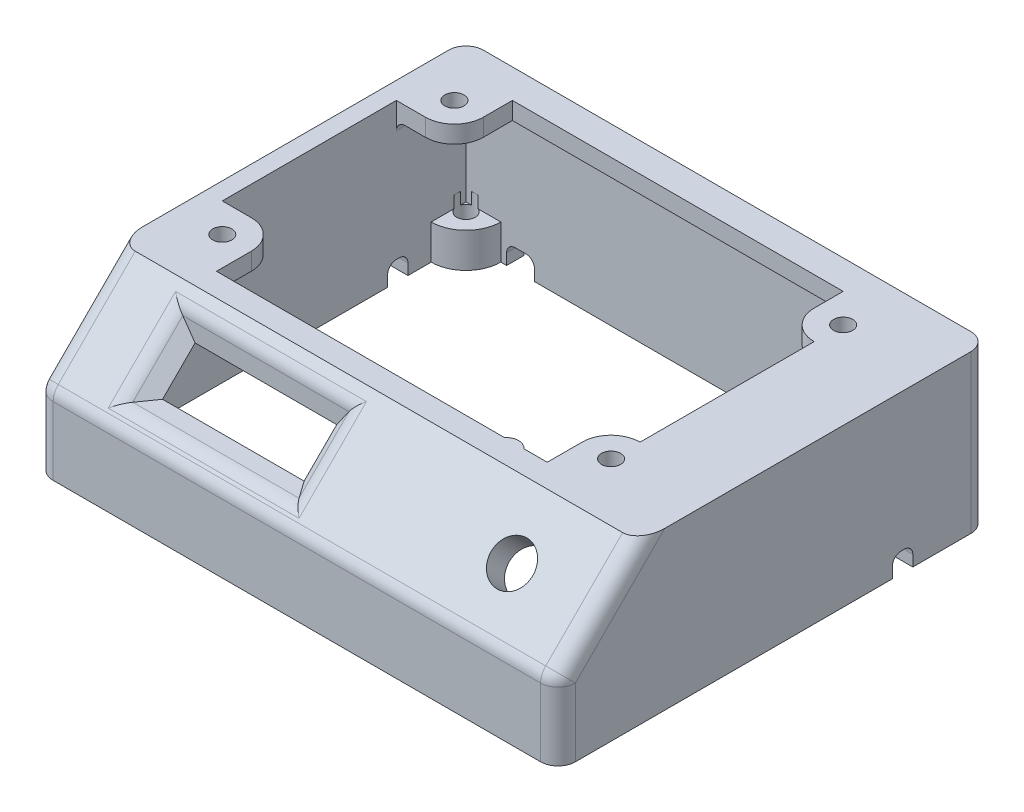
from build123d import *

# Parameters (mm, degrees)
SKETCH1_W                 = 90
SKETCH1_H                 = 60
BOSS_EXTRUDE1_DEPTH       = 3
SKETCH3_W                 = 89.99999999999999
SKETCH3_H                 = 20.000000000000004
BOSS_EXTRUDE2_DEPTH       = 3
SKETCH4_R                 = 3.600000000000001
CUT_EXTRUDE1_DEPTH        = 3
SKETCH5_R                 = 5.4999999999999964
SKETCH5_R_2               = 3.600000000000001
BOSS_EXTRUDE3_DEPTH       = 1.4
SKETCH6_W                 = 24.000000000000004
SKETCH6_H                 = 7.540000000000006
CUT_EXTRUDE2_DEPTH        = 3
CHAMFER1_SIZE             = 3.2
SKETCH7_R                 = 3.0000000000000018
SKETCH7_R_2               = 1.600000000000005
BOSS_EXTRUDE4_DEPTH       = 8.3
BOSS_EXTRUDE5_DEPTH       = 4
BOSS_EXTRUDE6_DEPTH       = 3
BOSS_EXTRUDE7_DEPTH       = 3
BOSS_EXTRUDE8_DEPTH       = 3
F_3_0MM_DOWEL_HOLE1_D     = 3.3
CUT_EXTRUDE3_DEPTH        = 3
BOSS_EXTRUDE9_DEPTH       = 6
F_1_0MM_DOWEL_HOLE1_D     = 3.2
F_1_0MM_DOWEL_HOLE1_DEPTH = 8
F_1_0MM_DOWEL_HOLE1_TIP   = 0.9613769904440965
FILLET1_R                 = 3
SKETCH20_W                = 3.000000000000014
SKETCH20_H                = 3.4999999999999982
CUT_EXTRUDE4_DEPTH        = 3.4
FILLET2_R                 = 1.5
CHAMFER2_SIZE             = 2.8


with BuildPart() as part:
    # Sketch1 → Boss-Extrude1 (new body)
    with BuildSketch(Plane(origin=(0, 0, 0), x_dir=(1, 0, 0), z_dir=(0, 1, 0))):
        Rectangle(SKETCH1_W, SKETCH1_H)
    extrude(amount=BOSS_EXTRUDE1_DEPTH)

    # Sketch3 → Boss-Extrude2 (add)
    with BuildSketch(Plane(origin=(0, 16.500000000000007, 16.499999999999954), x_dir=(1, 0, 0), z_dir=(0, 0.7071067811865488, 0.7071067811865464))):
        with Locations((-7.11e-15, -29.09188309203683)):
            Rectangle(SKETCH3_W, SKETCH3_H)
    extrude(amount=-BOSS_EXTRUDE2_DEPTH)

    # Sketch4 → Cut-Extrude1 (cut)
    with BuildSketch(Plane(origin=(0, 16.500000000000025, 16.499999999999964), x_dir=(1, 0, 0), z_dir=(0, 0.7071067811865486, 0.7071067811865465))):
        with Locations(Location((29.99999999999998, -29.09188309203682, 0), (0, 0, 270))):
            Circle(SKETCH4_R)
    extrude(amount=-CUT_EXTRUDE1_DEPTH, mode=Mode.SUBTRACT)

    # Sketch5 → Boss-Extrude3 (add)
    with BuildSketch(Plane(origin=(0, 14.378679656440374, 14.378679656440328), x_dir=(1, 0, 0), z_dir=(0, -0.7071067811865486, -0.7071067811865465))):
        with Locations(Location((29.99999999999998, 29.091883092036817, 0), (0, 0, 90))):
            Circle(SKETCH5_R)
        with Locations(Location((29.99999999999998, 29.091883092036817, 0), (0, 0, 90))):
            Circle(SKETCH5_R_2, mode=Mode.SUBTRACT)
    extrude(amount=BOSS_EXTRUDE3_DEPTH)

    # Sketch6 → Cut-Extrude2 (cut)
    with BuildSketch(Plane(origin=(0, 16.500000000000025, 16.499999999999964), x_dir=(1, 0, 0), z_dir=(0, 0.7071067811865486, 0.7071067811865465))):
        with Locations((-17.338558574922935, -29.09188309203713)):
            Rectangle(SKETCH6_W, SKETCH6_H)
    extrude(amount=-CUT_EXTRUDE2_DEPTH, mode=Mode.SUBTRACT)

    # Chamfer1
    # the kernel refuses this chamfer: 3.2 mm, written as the material it takes off along each edge
    with BuildSketch(Plane(origin=(-5.338558574922932, -1.4052752467923817, 34.40527524679243), x_dir=(0.9996219169112968, 0.019442520806010916, 0.019442520806010857), z_dir=(0, -0.7071067811865465, 0.7071067811865486))) as chamfer1_piece_1:
        Polygon((CHAMFER1_SIZE * 0.999621916911, -CHAMFER1_SIZE * 0.0274958766106), (-CHAMFER1_SIZE * 0.0274958766106, -CHAMFER1_SIZE * 0.999621916911), (0, 0), align=None)
    extrude(amount=7.5400000000000045, mode=Mode.SUBTRACT)
    with BuildSketch(Plane(origin=(-5.338558574922932, -6.736860376938946, 39.736860376939006), x_dir=(0, -0.6873969152646615, 0.7262819568766856), z_dir=(-1, 0, 0))) as chamfer1_piece_2:
        Polygon((CHAMFER1_SIZE * 0.999621916911, -CHAMFER1_SIZE * 0.0274958766106), (-CHAMFER1_SIZE * 0.0274958766106, -CHAMFER1_SIZE * 0.999621916911), (0, 0), align=None)
    extrude(amount=24.000000000000004, mode=Mode.SUBTRACT)
    with BuildSketch(Plane(origin=(-29.338558574922935, -1.4052752467923817, 34.40527524679243), x_dir=(0, 0.7262819568766835, -0.6873969152646636), z_dir=(1, 0, 0))) as chamfer1_piece_3:
        Polygon((CHAMFER1_SIZE * 0.999621916911, -CHAMFER1_SIZE * 0.0274958766106), (-CHAMFER1_SIZE * 0.0274958766106, -CHAMFER1_SIZE * 0.999621916911), (0, 0), align=None)
    extrude(amount=24.000000000000004, mode=Mode.SUBTRACT)
    with BuildSketch(Plane(origin=(-29.338558574922935, -6.736860376938946, 39.736860376939006), x_dir=(-0.9996219169112968, 0.019442520806011252, 0.019442520806011193), z_dir=(0, 0.7071067811865465, -0.7071067811865486))) as chamfer1_piece_4:
        Polygon((CHAMFER1_SIZE * 0.999621916911, -CHAMFER1_SIZE * 0.0274958766106), (-CHAMFER1_SIZE * 0.0274958766106, -CHAMFER1_SIZE * 0.999621916911), (0, 0), align=None)
    extrude(amount=7.5400000000000045, mode=Mode.SUBTRACT)
    with BuildSketch(Plane(origin=(-29.338558574922935, -1.4052752467923817, 34.40527524679243), x_dir=(0, 0.7262819568766835, -0.6873969152646636), z_dir=(1, 0, 0))) as chamfer1_piece_5a_section:
        Polygon((CHAMFER1_SIZE * 0.999621916911, -CHAMFER1_SIZE * 0.0274958766106), (-CHAMFER1_SIZE * 0.0274958766106, -CHAMFER1_SIZE * 0.999621916911), (0, 0), align=None)
    chamfer1_piece_5a = extrude(amount=32.229385561490915, mode=Mode.PRIVATE)
    chamfer1_piece_5a = split(chamfer1_piece_5a, bisect_by=Plane(origin=(-5.338558574922932, -1.4052752467923915, 32.91279966339028), z_dir=(1, 0, 0)), keep=Keep.TOP, mode=Mode.PRIVATE)
    with BuildSketch(Plane(origin=(-5.338558574922932, 4.413779088736488, 28.586220911263517), x_dir=(0.9996219169112966, 0.019442520806013983, 0.019442520806013924), z_dir=(0, -0.7071067811865465, 0.7071067811865486))) as chamfer1_piece_5b_section:
        Polygon((CHAMFER1_SIZE * 0.999621916911, -CHAMFER1_SIZE * 0.0274958766106), (-CHAMFER1_SIZE * 0.0274958766106, -CHAMFER1_SIZE * 0.999621916911), (0, 0), align=None)
    chamfer1_piece_5b = extrude(amount=15.769385561490923, mode=Mode.PRIVATE)
    chamfer1_piece_5b = split(chamfer1_piece_5b, bisect_by=Plane(origin=(-4.283218969143878, -2.1515130384933565, 33.65903745509146), z_dir=(0, 0.7071067811865466, -0.7071067811865486)), keep=Keep.TOP, mode=Mode.PRIVATE)
    chamfer1_piece_5 = chamfer1_piece_5a & chamfer1_piece_5b
    add(chamfer1_piece_5, mode=Mode.SUBTRACT)
    with BuildSketch(Plane(origin=(-5.338558574922932, -1.4052752467923817, 34.40527524679243), x_dir=(0.9996219169112968, 0.019442520806010916, 0.019442520806010857), z_dir=(0, -0.7071067811865465, 0.7071067811865486))) as chamfer1_piece_6a_section:
        Polygon((CHAMFER1_SIZE * 0.999621916911, -CHAMFER1_SIZE * 0.0274958766106), (-CHAMFER1_SIZE * 0.0274958766106, -CHAMFER1_SIZE * 0.999621916911), (0, 0), align=None)
    chamfer1_piece_6a = extrude(amount=15.76938556149092, mode=Mode.PRIVATE)
    chamfer1_piece_6a = split(chamfer1_piece_6a, bisect_by=Plane(origin=(-4.283218969143861, -7.4830981686397395, 38.990622585238214), z_dir=(0, -0.7071067811865466, 0.7071067811865486)), keep=Keep.TOP, mode=Mode.PRIVATE)
    with BuildSketch(Plane(origin=(2.8908269865679914, -6.736860376938956, 39.736860376939), x_dir=(0, -0.6873969152646588, 0.7262819568766881), z_dir=(-1, 0, 0))) as chamfer1_piece_6b_section:
        Polygon((CHAMFER1_SIZE * 0.999621916911, -CHAMFER1_SIZE * 0.0274958766106), (-CHAMFER1_SIZE * 0.0274958766106, -CHAMFER1_SIZE * 0.999621916911), (0, 0), align=None)
    chamfer1_piece_6b = extrude(amount=32.22938556149093, mode=Mode.PRIVATE)
    chamfer1_piece_6b = split(chamfer1_piece_6b, bisect_by=Plane(origin=(-5.338558574922932, -8.2293359603411, 39.736860376939), z_dir=(1, 0, 0)), keep=Keep.TOP, mode=Mode.PRIVATE)
    chamfer1_piece_6 = chamfer1_piece_6a & chamfer1_piece_6b
    add(chamfer1_piece_6, mode=Mode.SUBTRACT)
    with BuildSketch(Plane(origin=(-5.338558574922932, -6.736860376938946, 39.736860376939006), x_dir=(0, -0.6873969152646615, 0.7262819568766856), z_dir=(-1, 0, 0))) as chamfer1_piece_7a_section:
        Polygon((CHAMFER1_SIZE * 0.999621916911, -CHAMFER1_SIZE * 0.0274958766106), (-CHAMFER1_SIZE * 0.0274958766106, -CHAMFER1_SIZE * 0.999621916911), (0, 0), align=None)
    chamfer1_piece_7a = extrude(amount=32.22938556149093, mode=Mode.PRIVATE)
    chamfer1_piece_7a = split(chamfer1_piece_7a, bisect_by=Plane(origin=(-29.338558574922935, -8.229335960341102, 39.736860376939), z_dir=(-1, 0, 0)), keep=Keep.TOP, mode=Mode.PRIVATE)
    with BuildSketch(Plane(origin=(-29.338558574922935, -12.555914712467843, 45.5559147124679), x_dir=(-0.9996219169112966, 0.019442520806014486, 0.019442520806014427), z_dir=(0, 0.7071067811865465, -0.7071067811865486))) as chamfer1_piece_7b_section:
        Polygon((CHAMFER1_SIZE * 0.999621916911, -CHAMFER1_SIZE * 0.0274958766106), (-CHAMFER1_SIZE * 0.0274958766106, -CHAMFER1_SIZE * 0.999621916911), (0, 0), align=None)
    chamfer1_piece_7b = extrude(amount=15.76938556149093, mode=Mode.PRIVATE)
    chamfer1_piece_7b = split(chamfer1_piece_7b, bisect_by=Plane(origin=(-30.393898180701953, -7.483098168640018, 38.99062258523794), z_dir=(0, -0.7071067811865466, 0.7071067811865486)), keep=Keep.TOP, mode=Mode.PRIVATE)
    chamfer1_piece_7 = chamfer1_piece_7a & chamfer1_piece_7b
    add(chamfer1_piece_7, mode=Mode.SUBTRACT)
    with BuildSketch(Plane(origin=(-37.56794413641384, -1.4052752467923928, 34.405275246792414), x_dir=(0, 0.7262819568766864, -0.6873969152646605), z_dir=(1, 0, 0))) as chamfer1_piece_8a_section:
        Polygon((CHAMFER1_SIZE * 0.999621916911, -CHAMFER1_SIZE * 0.0274958766106), (-CHAMFER1_SIZE * 0.0274958766106, -CHAMFER1_SIZE * 0.999621916911), (0, 0), align=None)
    chamfer1_piece_8a = extrude(amount=32.229385561490915, mode=Mode.PRIVATE)
    chamfer1_piece_8a = split(chamfer1_piece_8a, bisect_by=Plane(origin=(-29.338558574922935, -1.405275246792396, 32.91279966339027), z_dir=(-1, 0, 0)), keep=Keep.TOP, mode=Mode.PRIVATE)
    with BuildSketch(Plane(origin=(-29.338558574922935, -6.736860376938946, 39.736860376939006), x_dir=(-0.9996219169112968, 0.019442520806011252, 0.019442520806011193), z_dir=(0, 0.7071067811865465, -0.7071067811865486))) as chamfer1_piece_8b_section:
        Polygon((CHAMFER1_SIZE * 0.999621916911, -CHAMFER1_SIZE * 0.0274958766106), (-CHAMFER1_SIZE * 0.0274958766106, -CHAMFER1_SIZE * 0.999621916911), (0, 0), align=None)
    chamfer1_piece_8b = extrude(amount=15.769385561490939, mode=Mode.PRIVATE)
    chamfer1_piece_8b = split(chamfer1_piece_8b, bisect_by=Plane(origin=(-30.393898180701893, -2.15151303849358, 33.65903745509123), z_dir=(0, 0.7071067811865466, -0.7071067811865486)), keep=Keep.TOP, mode=Mode.PRIVATE)
    chamfer1_piece_8 = chamfer1_piece_8a & chamfer1_piece_8b
    add(chamfer1_piece_8, mode=Mode.SUBTRACT)

    # Sketch7 → Boss-Extrude4 (add)
    with BuildSketch(Plane(origin=(0, 14.378679656440374, 14.378679656440328), x_dir=(1, 0, 0), z_dir=(0, -0.7071067811865486, -0.7071067811865465))):
        with Locations(Location((19.290000000000294, 20.841883092036912, 0), (0, 0, 350.263355366))):
            Circle(SKETCH7_R)
        with Locations(Location((19.290000000000294, 20.841883092036912, 0), (0, 0, 198.487609579))):
            Circle(SKETCH7_R_2, mode=Mode.SUBTRACT)
    extrude(amount=BOSS_EXTRUDE4_DEPTH)

    # Sketch8 → Boss-Extrude5 (add)
    with BuildSketch(Plane(origin=(0, 14.378679656440374, 14.378679656440328), x_dir=(1, 0, 0), z_dir=(0, -0.7071067811865486, -0.7071067811865465))):
        Polygon((-35.53855857492294, 23.871883092037123), (2.6614414250770646, 23.871883092037127), (2.6614414250770646, 36.071883092037126), (-35.53855857492294, 36.071883092037126), (-35.53855857492294, 38.971883092037125), (5.561441425077065, 38.971883092037125), (5.561441425077065, 20.971883092037128), (-35.53855857492294, 20.97188309203712), align=None)
    extrude(amount=BOSS_EXTRUDE5_DEPTH)

    # Sketch9 → Boss-Extrude6 (add)
    with BuildSketch(Plane.XY.offset(44.14213562373099)):
        Polygon((-44.99999999999999, -11.142135623730935), (44.99999999999998, -11.142135623730935), (44.99999999999997, -24.142135623730937), (-45, -24.142135623730937), align=None)
    extrude(amount=-BOSS_EXTRUDE6_DEPTH)

    # Sketch10 → Boss-Extrude7 (add)
    with BuildSketch(Plane(origin=(44.99999999999999, 0, 0), x_dir=(0, 0, -1), z_dir=(1, 0, 0))):
        Polygon((-28.75735931288073, -8.13e-15), (30.000000000000004, 0), (30.000000000000007, -24.142135623730937), (-41.14213562373099, -24.142135623730937), (-41.142135623730994, -12.384776310850228), align=None)
    boss_extrude7 = extrude(amount=-BOSS_EXTRUDE7_DEPTH)

    # Mirror1: Boss-Extrude7 across plane
    add(boss_extrude7.mirror(Plane(origin=(0, 0, 0), x_dir=(0, 0, 1), z_dir=(1, 0, 0))))

    # Sketch11 → Boss-Extrude8 (add)
    with BuildSketch(Plane(origin=(0, 0, -30.000000000000004), x_dir=(-1, 0, 0), z_dir=(0, 0, -1))):
        Polygon((41.999999999999986, -24.142135623730937), (-41.999999999999986, -24.142135623730947), (-41.999999999999986, 0), (41.999999999999986, 0), align=None)
    extrude(amount=-BOSS_EXTRUDE8_DEPTH)

    # Ø3.0mm Dowel Hole1 (through all)
    with Locations(Plane(origin=(0, 0, 0), x_dir=(-1, 0, 0), z_dir=(0, -1, 0))):
        with Locations((37, 20), (37, -20), (-30, 20), (-30, -20)):
            Hole(F_3_0MM_DOWEL_HOLE1_D / 2)

    # Sketch15 → Cut-Extrude3 (cut)
    with BuildSketch(Plane(origin=(0, 0, 0), x_dir=(-1, 0, 0), z_dir=(0, -1, 0))):
        with BuildLine():
            Line((-24.99999999999999, 20.000000000000007), (-24.99999999999999, 25))
            Line((-24.99999999999999, 25), (32.00000000000001, 25))
            Line((32.00000000000001, 25), (32.00000000000001, 20.000000000000004))
            ThreePointArc((32.00000000000001, 20.000000000000004), (33.46446609406727, 16.46446609406727), (37, 15.000000000000014))
            Line((37, 15.000000000000014), (41.99999999999999, 15.000000000000016))
            Line((41.99999999999999, 15.000000000000016), (41.99999999999999, -15.000000000000014))
            Line((41.99999999999999, -15.000000000000014), (36.99999999999999, -15.000000000000014))
            ThreePointArc((36.99999999999999, -15.000000000000014), (33.46446609406727, -16.46446609406727), (32.00000000000001, -19.999999999999996))
            Line((32.00000000000001, -19.999999999999996), (32, -25.999999999999996))
            Line((32, -25.999999999999996), (-17.568771872805467, -25.999999999999996))
            add(Edge.make_bspline(
                [(-17.568771872805467, -25.999999999999996), (-19.29000000000029, -24.294829399567405), (-21.011228127195118, -25.999999999999996)],
                knots=[2.5305244194596073, 2.5305244194596073, 2.5305244194596073, 3.7526608877199776, 3.7526608877199776, 3.7526608877199776], degree=2, weights=[1, 0.8190355937288819, 1]))
            Line((-21.011228127195118, -25.999999999999996), (-24.99999999999999, -25.999999999999996))
            Line((-24.99999999999999, -25.999999999999996), (-24.99999999999999, -19.999999999999996))
            ThreePointArc((-24.99999999999999, -19.999999999999996), (-26.46446609406725, -16.464466094067255), (-29.999999999999993, -14.999999999999996))
            Line((-29.999999999999993, -14.999999999999996), (-29.999999999999993, 15.000000000000007))
            ThreePointArc((-29.999999999999993, 15.000000000000007), (-26.464466094067255, 16.46446609406727), (-24.99999999999999, 20.000000000000007))
        make_face()
    extrude(amount=-CUT_EXTRUDE3_DEPTH, mode=Mode.SUBTRACT)

    # Sketch16 → Boss-Extrude9 (add)
    with BuildSketch(Plane(origin=(0, -24.142135623730937, 0), x_dir=(-1, 0, 0), z_dir=(0, -1, 0))):
        with BuildLine():
            Line((41.999999999999986, -41.14213562373099), (35.99999999999999, -41.14213562373099))
            ThreePointArc((35.99999999999999, -41.14213562373099), (37.7573593128807, -36.8994949366117), (41.999999999999986, -35.14213562373099))
            Line((41.999999999999986, -35.14213562373099), (41.999999999999986, -41.14213562373099))
        make_face()
        with BuildLine():
            Line((-41.999999999999986, 27.000000000000004), (-35.99999999999999, 27.000000000000004))
            ThreePointArc((-35.99999999999999, 27.000000000000004), (-37.7573593128807, 22.75735931288072), (-41.999999999999986, 21.000000000000004))
            Line((-41.999999999999986, 21.000000000000004), (-41.999999999999986, 27.000000000000004))
        make_face()
        with BuildLine():
            Line((-41.999999999999986, -41.14213562373099), (-41.999999999999986, -35.14213562373099))
            ThreePointArc((-41.999999999999986, -35.14213562373099), (-37.75735931288071, -36.89949493661171), (-35.99999999999999, -41.14213562373099))
            Line((-35.99999999999999, -41.14213562373099), (-41.999999999999986, -41.14213562373099))
        make_face()
        with BuildLine():
            Line((35.99999999999999, 27.000000000000004), (41.999999999999986, 27.000000000000004))
            Line((41.999999999999986, 27.000000000000004), (41.999999999999986, 21.000000000000004))
            ThreePointArc((41.999999999999986, 21.000000000000004), (37.7573593128807, 22.757359312880723), (35.99999999999999, 27.000000000000004))
        make_face()
    extrude(amount=-BOSS_EXTRUDE9_DEPTH)

    # Ø1.0mm Dowel Hole1
    with Locations(Plane(origin=(0, -24.142135623730937, 0), x_dir=(-1, 0, 0), z_dir=(0, -1, 0))):
        with Locations((-40.5, -39.642135624), (-40.5, 25.5), (40.5, 25.5), (40.5, -39.642135624)):
            Hole(F_1_0MM_DOWEL_HOLE1_D / 2, depth=F_1_0MM_DOWEL_HOLE1_DEPTH)
            with Locations((0, 0, -(F_1_0MM_DOWEL_HOLE1_DEPTH + F_1_0MM_DOWEL_HOLE1_TIP / 2))):  # 118° drill point
                Cone(0, F_1_0MM_DOWEL_HOLE1_D / 2, F_1_0MM_DOWEL_HOLE1_TIP, mode=Mode.SUBTRACT)

    # Fillet1
    fillet1_edges = [part.edges().sort_by_distance(p)[0] for p in [
        (-45, -17.642135623730937, 44.14213562373099),
        (44.99999999999997, -17.642135623730937, 44.14213562373099),
        (-45, -4.071067811865468, 37.071067811865504),
        (-7.11e-15, -11.14213562373093, 44.14213562373099),
        (44.999999999999986, -4.071067811865468, 37.071067811865504),
        (-32.53855857492205, -4.071067811865601, 37.071067811865404),
        (-17.338558574923, 0.8574664530041818, 32.14253354699562),
        (-17.338558574923, -8.999602076735382, 41.99960207673519),
        (-2.1385585749239473, -4.0710678118656, 37.071067811865404),
        (-45, -10.571067811865468, -30.000000000000007),
        (44.99999999999999, -10.571067811865468, -30.000000000000007),
    ]]
    fillet(fillet1_edges, radius=FILLET1_R)

    # Sketch20 → Cut-Extrude4 (cut)
    with BuildSketch(Plane(origin=(0, -24.142135623730937, 0), x_dir=(-1, 0, 0), z_dir=(0, -1, 0))):
        Polygon((-44.99999999999998, 17.000000000000007), (-41.999999999999986, 17.000000000000007), (-41.999999999999986, 13.500000000000012), (-44.99999999999998, 13.500000000000009), align=None)
        Polygon((30.199999999999992, 30.000000000000007), (34.99999999999999, 30.000000000000007), (34.999999999999986, 27.000000000000004), (30.199999999999992, 27.000000000000004), align=None)
        with Locations((43.49999999999999, 15.250000000000007)):
            Rectangle(SKETCH20_W, SKETCH20_H)
    extrude(amount=-CUT_EXTRUDE4_DEPTH, mode=Mode.SUBTRACT)

    # Fillet2
    # the kernel refuses this fillet: 1.5 mm, written as the material it adds along each edge
    with BuildSketch(Plane(origin=(29.99999999999998, -6.192388155425094, 34.94974746830586), x_dir=(0, -0.7071067811865462, 0.7071067811865489), z_dir=(1, 0, 0))) as fillet2_piece_1:
        with BuildLine():
            CenterArc((6.996662954709571, 1.500000000000014), FILLET2_R, 183.82255372927486, 86.17744627072534)
            Line((5.499999999999995, 1.4), (5.499999999999995, 2.2e-16))
            Line((5.499999999999995, 2.2e-16), (6.996662954709575, 1.297e-14))
        make_face()
    revolve(axis=Axis((29.99999999999998, -6.192388155425094, 34.94974746830586), (0, -0.7071067811865486, -0.7071067811865465)))
    with BuildSketch(Plane(origin=(-41.99999999999999, 0, 32.50735931288073), x_dir=(1, 0, 0), z_dir=(0, 1.4e-16, -1))) as fillet2_piece_2:
        with BuildLine():
            CenterArc((FILLET2_R, FILLET2_R), FILLET2_R, 180, 90)
            Line((0, FILLET2_R), (0, 0))
            Line((0, 0), (FILLET2_R, 0))
        make_face()
    extrude(amount=17.507359312880716)
    with BuildSketch(Plane(origin=(-41.99999999999999, -2.08e-15, -15.000000000000014), x_dir=(1, 1.38e-15, 0), z_dir=(0, 1.4e-16, -1))) as fillet2_piece_3:
        with BuildLine():
            CenterArc((FILLET2_R, FILLET2_R), FILLET2_R, 180, 90.00000000000006)
            Line((-2.08e-15, FILLET2_R), (0, 0))
            Line((0, 0), (FILLET2_R, 0))
        make_face()
    extrude(amount=11.999999999999993)
    with BuildSketch(Plane(origin=(45.749999999999986, 0, -27.000000000000004), x_dir=(0, 0, 1), z_dir=(-1, 0, 0))) as fillet2_piece_4_section:
        with BuildLine():
            CenterArc((FILLET2_R, -FILLET2_R), FILLET2_R, 90, 90)
            Line((0, -FILLET2_R), (0, 0))
            Line((0, 0), (FILLET2_R, 0))
        make_face()
    fillet2_piece_4 = extrude(amount=91.49999999999997, mode=Mode.PRIVATE)
    fillet2_piece_4 = split(fillet2_piece_4, bisect_by=Plane(origin=(44.99999999999999, -0.3373041475431774, -26.66931225832173), z_dir=(-1, 0, 0)), keep=Keep.TOP, mode=Mode.PRIVATE)
    fillet2_piece_4 = split(fillet2_piece_4, bisect_by=Plane(origin=(-45.00000000000001, -0.3373041475431774, -26.669312258321728), z_dir=(1, 0, 0)), keep=Keep.TOP, mode=Mode.PRIVATE)
    add(fillet2_piece_4)
    with BuildSketch(Plane(origin=(41.99999999999999, 0, 32.50735931288073), x_dir=(-1, 0, 0), z_dir=(0, 1.4e-16, -1))) as fillet2_piece_5:
        with BuildLine():
            CenterArc((FILLET2_R, -FILLET2_R), FILLET2_R, 90, 90)
            Line((0, -FILLET2_R), (0, 0))
            Line((0, 0), (FILLET2_R, 0))
        make_face()
    extrude(amount=59.50735931288074)
    with BuildSketch(Plane(origin=(20.693485661574975, 0, 28.757359312880727), x_dir=(0, 0, -1), z_dir=(1, 0, 0))) as fillet2_piece_6_section:
        with BuildLine():
            CenterArc((FILLET2_R * 0.414213562373, -FILLET2_R), FILLET2_R, 90, 44.999999999999886)
            Line((-FILLET2_R * 0.292893218813, -FILLET2_R * 0.292893218813), (0, 0))
            Line((0, 0), (FILLET2_R * 0.414213562373, 0))
        make_face()
    fillet2_piece_6 = extrude(amount=22.859815197324124, mode=Mode.PRIVATE)
    fillet2_piece_6 = fillet2_piece_6 - Plane(origin=(19.290000000000294, -0.4226416886589909, 29.052232045494062), x_dir=(-0.9483922513188057, 0.2242232566421769, -0.22422325664217757), z_dir=(0, 0.7071067811865486, 0.7071067811865465)) * Cylinder(1.600000000000005, 49, mode=Mode.PRIVATE)
    add(fillet2_piece_6)
    with BuildSketch(Plane(origin=(-43.5533008588991, 8.9e-16, 28.757359312880727), x_dir=(0, -0.7071067811865481, 0.707106781186547), z_dir=(1, 0, 0))) as fillet2_piece_7_section:
        with BuildLine():
            CenterArc((FILLET2_R * 0.414213562373, FILLET2_R), FILLET2_R, 224.99999999999994, 44.999999999999886)
            Line((-FILLET2_R * 0.292893218813, FILLET2_R * 0.292893218813), (0, 0))
            Line((0, 0), (FILLET2_R * 0.414213562373, 1e-17))
        make_face()
    fillet2_piece_7 = extrude(amount=61.43981519732847, mode=Mode.PRIVATE)
    fillet2_piece_7 = fillet2_piece_7 - Plane(origin=(19.290000000000294, -0.42259570165629834, 29.052278032496755), x_dir=(-0.9483922513188057, 0.2242232566421769, -0.22422325664217757), z_dir=(0, 0.7071067811865486, 0.7071067811865465)) * Cylinder(1.600000000000005, 126, mode=Mode.PRIVATE)
    add(fillet2_piece_7)
    with BuildSketch(Plane(origin=(19.290000000000294, -0.35875721063615273, 29.1161165235169), x_dir=(0.147846480168706, 0.6993359058069736, -0.6993359058069766), z_dir=(-0.9890103226466975, 0.1045432487018543, -0.10454324870185457))) as fillet2_piece_8:
        with BuildLine():
            CenterArc((3.0000000000000036 + FILLET2_R, FILLET2_R), FILLET2_R, 179.99999999999994, 90.00000000000006)
            Line((3.000000000000004, FILLET2_R), (3.0000000000000036, 1.334e-14))
            Line((3.0000000000000036, 1.334e-14), (3.0000000000000036 + FILLET2_R, 1.233e-14))
        make_face()
    revolve(axis=Axis((19.290000000000294, -0.35875721063615273, 29.1161165235169), (0, -0.7071067811865486, -0.7071067811865466)), revolution_arc=342.99570501281494)
    with BuildSketch(Plane(origin=(-45, -20.742135623730938, -13.500000000000009), x_dir=(0, -1, 0), z_dir=(1, 0, 0))) as fillet2_piece_9:
        with BuildLine():
            CenterArc((FILLET2_R, FILLET2_R), FILLET2_R, 180, 90)
            Line((0, FILLET2_R), (0, 0))
            Line((0, 0), (FILLET2_R, 0))
        make_face()
    extrude(amount=3.000000000000014)
    with BuildSketch(Plane(origin=(-41.999999999999986, -20.742135623730938, -17.000000000000007), x_dir=(0, 0, 1), z_dir=(-1, 0, 0))) as fillet2_piece_10:
        with BuildLine():
            CenterArc((FILLET2_R, -FILLET2_R), FILLET2_R, 90, 90)
            Line((0, -FILLET2_R), (0, 0))
            Line((0, 0), (FILLET2_R, 0))
        make_face()
    extrude(amount=3.000000000000014)
    with BuildSketch(Plane(origin=(-30.199999999999992, -20.742135623730938, -27.000000000000004), x_dir=(0, -1, 0), z_dir=(0, 0, -1))) as fillet2_piece_11:
        with BuildLine():
            CenterArc((FILLET2_R, FILLET2_R), FILLET2_R, 180, 90)
            Line((0, FILLET2_R), (0, 0))
            Line((0, 0), (FILLET2_R, 0))
        make_face()
    extrude(amount=3.0000000000000036)
    with BuildSketch(Plane(origin=(-34.99999999999999, -20.742135623730938, -30.000000000000007), x_dir=(1, 0, -2.37e-15), z_dir=(2.37e-15, 0, 1))) as fillet2_piece_12:
        with BuildLine():
            CenterArc((FILLET2_R, -FILLET2_R), FILLET2_R, 90, 90)
            Line((0, -FILLET2_R), (0, 0))
            Line((0, 0), (FILLET2_R, 0))
        make_face()
    extrude(amount=3.0000000000000036)
    with BuildSketch(Plane(origin=(41.999999999999986, -20.742135623730938, -13.500000000000012), x_dir=(1.18e-15, 0, -1), z_dir=(1, 0, 1.18e-15))) as fillet2_piece_13:
        with BuildLine():
            CenterArc((FILLET2_R, -FILLET2_R), FILLET2_R, 90, 90)
            Line((0, -FILLET2_R), (0, 0))
            Line((0, 0), (FILLET2_R, 0))
        make_face()
    extrude(amount=2.999999999999993)
    with BuildSketch(Plane(origin=(44.99999999999998, -20.742135623730938, -17.000000000000007), x_dir=(0, -1, 0), z_dir=(-1, 0, 0))) as fillet2_piece_14:
        with BuildLine():
            CenterArc((FILLET2_R, FILLET2_R), FILLET2_R, 180, 90)
            Line((0, FILLET2_R), (0, 0))
            Line((0, 0), (FILLET2_R, 0))
        make_face()
    extrude(amount=2.999999999999993)

    # Chamfer2
    chamfer2_edges = [part.edges().sort_by_distance(p)[0] for p in [
        (-14.988558574922935, -3.2791082169367485, 26.379613280325117),
        (5.561441425077065, -9.643069247615667, 32.74357431100405),
        (-14.988558574922937, -16.007030278294586, 39.10753534168299),
    ]]
    chamfer(chamfer2_edges, length=CHAMFER2_SIZE)


solid = part.part
